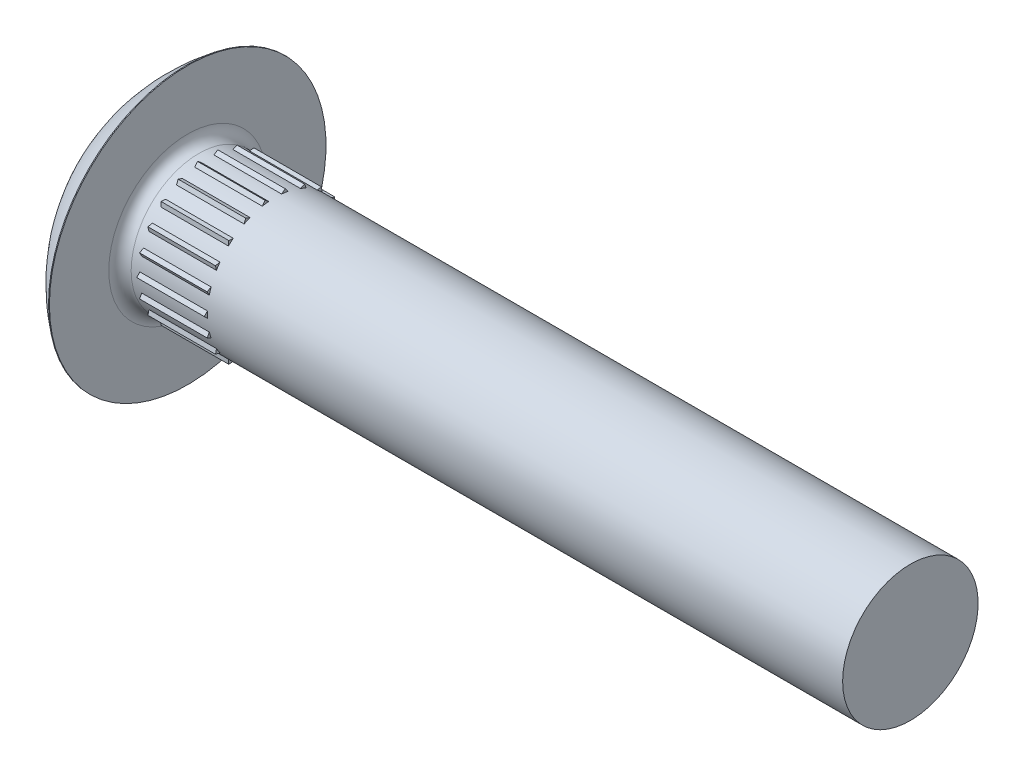
from build123d import *

# Parameters (mm, degrees)
BOSS_EXTRUDE1_DEPTH = 9.4996
CIRPATTERN1_COUNT   = 22


# Read off the part's stored shape, not the designer's step: ThreadSchematic
with BuildPart() as part:
    # ThreadSchematic outline → ThreadSchematic (revolve)
    with BuildSketch(Plane.YX):
        with BuildLine():
            Line((0, 111.5314), (0, 0))
            ThreePointArc((0, 0), (10.887880066, 2.589775097), (19.443700005, 9.804400006))
            Line((19.443700005, 9.804400006), (19.4437, 9.9314))
            Line((19.4437, 9.9314), (11.0998, 9.9314))
            ThreePointArc((11.0998, 9.9314), (9.986248241, 10.392648241), (9.525, 11.5062))
            Line((9.525, 11.5062), (9.525, 111.5314))
            Line((9.525, 111.5314), (0, 111.5314))
        make_face()
    revolve(axis=Axis((0, 0, 0), (1, 0, 0)))

    # Sketch2 → Boss-Extrude1 (add)
    with BuildSketch(Plane(origin=(12.7254, 0, 0), x_dir=(0, 0, -1), z_dir=(1, 0, 0))):
        Polygon((-9.9695, 0), (-9.514107563, -0.455392437), (0, 0), (-9.514107563, 0.455392437), align=None)
    boss_extrude1 = extrude(amount=BOSS_EXTRUDE1_DEPTH)

    # CirPattern1: Boss-Extrude1 ×22 about axis
    cirpattern1_axis = Axis((0, 0, 0), (1, 0, 0))
    for i in range(1, CIRPATTERN1_COUNT):
        add(boss_extrude1.rotate(cirpattern1_axis, i * 360 / CIRPATTERN1_COUNT))


solid = part.part
